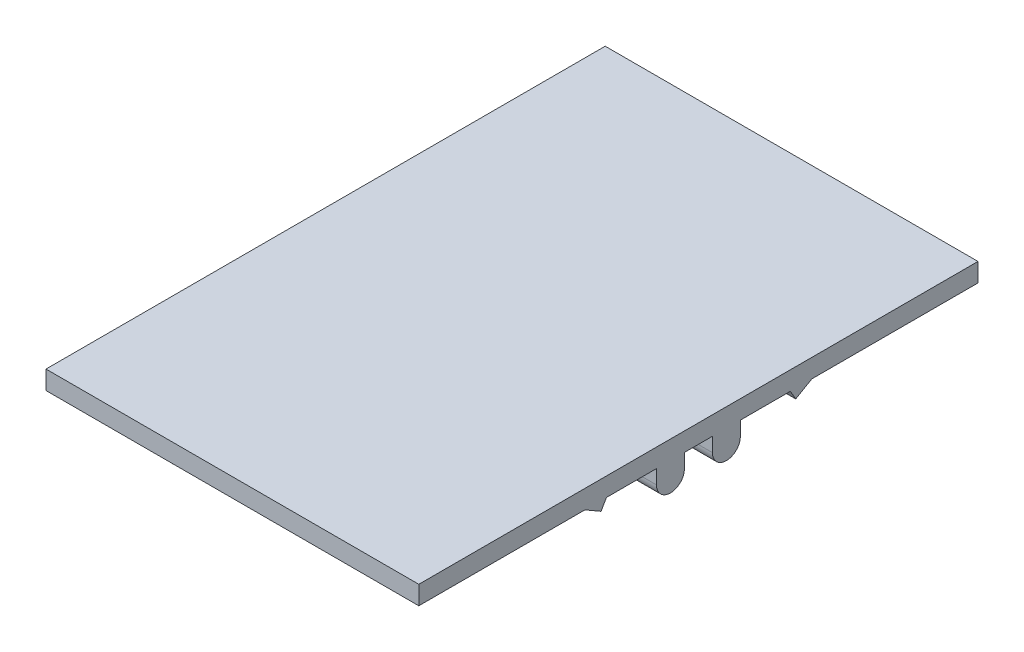
from build123d import *

# Parameters (mm, degrees)
SKETCH1_W            = 400
SKETCH1_H            = 600
BOSS_EXTRUDE1_DEPTH  = 20
BOSS_EXTRUDE2_DEPTH  = 30
MIRROR2_COPY_1_DEPTH = 30
BOSS_EXTRUDE3_DEPTH  = 40
MIRROR4_COPY_1_DEPTH = 40


with BuildPart() as part:
    # Sketch1 → Boss-Extrude1 (new body)
    with BuildSketch(Plane(origin=(0, 0, 0), x_dir=(1, 0, 0), z_dir=(0, 1, 0))):
        Rectangle(SKETCH1_W, SKETCH1_H)
    extrude(amount=BOSS_EXTRUDE1_DEPTH)

    # Sketch3 → Boss-Extrude2 (add)
    with BuildSketch(Plane(origin=(200, 0, 0), x_dir=(0, 0, -1), z_dir=(1, 0, 0))):
        with BuildLine():
            Line((-45, -15.146106113), (-45, 0))
            Line((-45, 0), (-15, 0))
            Line((-15, 0), (-15, -15.146106113))
            ThreePointArc((-15, -15.146106113), (-30, -30.146106113), (-45, -15.146106113))
        make_face()
    boss_extrude2 = extrude(amount=-BOSS_EXTRUDE2_DEPTH)

    # Mirror1: Boss-Extrude2 across plane
    add(boss_extrude2.mirror(Plane.XY))

    # Mirror2: Boss-Extrude2 across plane
    add(boss_extrude2.mirror(Plane(origin=(0, 0, 0), x_dir=(0, 0, 1), z_dir=(1, 0, 0))))

    # Mirror2 copy 1 sketch → Mirror2 copy 1 (add)
    with BuildSketch(Plane.ZY.offset(200)):
        with BuildLine():
            Line((-45, -15.146106113), (-45, 0))
            Line((-45, 0), (-15, 0))
            Line((-15, 0), (-15, -15.146106113))
            ThreePointArc((-15, -15.146106113), (-30, -30.146106113), (-45, -15.146106113))
        make_face()
    extrude(amount=-MIRROR2_COPY_1_DEPTH)

    # Sketch4 → Boss-Extrude3 (add)
    with BuildSketch(Plane(origin=(200, 0, 0), x_dir=(0, 0, -1), z_dir=(1, 0, 0))):
        Polygon((-121.760513267, 0), (-104.440005192, -10), (-98.6665025, 0), align=None)
    boss_extrude3 = extrude(amount=-BOSS_EXTRUDE3_DEPTH)

    # Mirror3: Boss-Extrude3 across plane
    add(boss_extrude3.mirror(Plane.XY))

    # Mirror4: Boss-Extrude3 across plane
    add(boss_extrude3.mirror(Plane(origin=(0, 0, 0), x_dir=(0, 0, 1), z_dir=(1, 0, 0))))

    # Mirror4 copy 1 sketch → Mirror4 copy 1 (add)
    with BuildSketch(Plane.ZY.offset(200)):
        Polygon((-121.760513267, 0), (-104.440005192, -10), (-98.6665025, 0), align=None)
    extrude(amount=-MIRROR4_COPY_1_DEPTH)


solid = part.part
